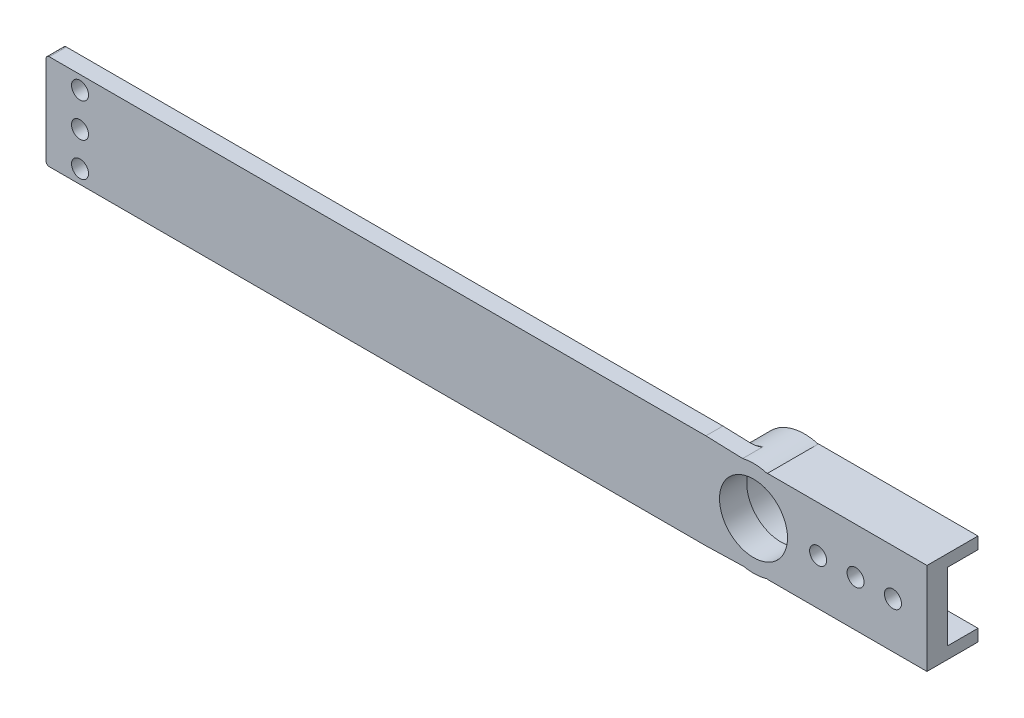
from build123d import *

# Parameters (mm, degrees)
SKETCH_1_W          = 40
SKETCH_1_H          = 20
EXTRUDE_1_DEPTH     = 6
SKETCH_2_R          = 2.5
CUT_EXTRUDE_1_DEPTH = 24.151673806
SKETCH_3_R          = 11
EXTRUDE_2_DEPTH     = 15
SKETCH_5_R          = 11
SKETCH_5_R_2        = 10
EXTRUDE_3_DEPTH     = 8
EXTRUDE_4_DEPTH     = 5
FILLET_1_R          = 1
FILLET_2_R          = 1
SKETCH_9_R          = 2.5
CUT_EXTRUDE_2_DEPTH = 5


with BuildPart() as part:
    # 草图1 → 凸台-拉伸1 (new body)
    with BuildSketch(Plane.XY):
        Rectangle(SKETCH_1_W, SKETCH_1_H)
    extrude(amount=EXTRUDE_1_DEPTH)

    # 草图2 → 切除-拉伸1 (cut, through all)
    with BuildSketch(Plane.XY.offset(6)):
        with Locations((10, 0)):
            Circle(SKETCH_2_R)
        with Locations((-1, 0)):
            Circle(SKETCH_2_R)
        with Locations((-12, 0)):
            Circle(SKETCH_2_R)
    extrude(amount=-CUT_EXTRUDE_1_DEPTH, mode=Mode.SUBTRACT)

    # 草图3 → 凸台-拉伸2 (add)
    with BuildSketch(Plane.XY.offset(6)):
        with BuildLine():
            Line((20, 10), (20, 13.5))
            Line((20, 13.5), (-26.893967141, 13.5))
            Line((-26.893967141, 13.5), (-26.893967141, 13.384337644))
            ThreePointArc((-26.893967141, 13.384337644), (-45, 0), (-26.893967141, -13.384337644))
            Line((-26.893967141, -13.384337644), (-26.893967141, -13.5))
            Line((-26.893967141, -13.5), (20, -13.5))
            Line((20, -13.5), (20, -10))
            Line((20, -10), (-20, -10))
            Line((-20, -10), (-20, -8.660254038))
            ThreePointArc((-20, -8.660254038), (-17, 0), (-20, 8.660254038))
            Line((-20, 8.660254038), (-20, 10))
            Line((-20, 10), (20, 10))
        make_face()
        with Locations((-31, 0)):
            Circle(SKETCH_3_R, mode=Mode.SUBTRACT)
    extrude(amount=-EXTRUDE_2_DEPTH)

    # 草图5 → 凸台-拉伸3 (add)
    with BuildSketch(Plane.XY.offset(6)):
        with Locations((-31, 0)):
            Circle(SKETCH_5_R)
        with Locations((-31, 0)):
            Circle(SKETCH_5_R_2, mode=Mode.SUBTRACT)
    extrude(amount=-EXTRUDE_3_DEPTH)

    # 草图8 → 凸台-拉伸4 (add)
    with BuildSketch(Plane.XY.offset(6)):
        with BuildLine():
            ThreePointArc((-33.911999365, -13.693803697), (-44.999289152, -0.141078849), (-34.187380521, 13.632336755))
            Line((-34.187380521, 13.632336755), (-45, 14))
            Line((-45, 14), (-239, 14))
            Line((-239, 14), (-239, -14))
            Line((-239, -14), (-45, -14))
            Line((-45, -14), (-33.911999365, -13.693803697))
        make_face()
    extrude(amount=-EXTRUDE_4_DEPTH)

    # 圆角1
    fillet_1_edges = [part.edges().sort_by_distance(p)[0] for p in [
        (-44.999289152, -0.141078849, 1),
    ]]
    fillet(fillet_1_edges, radius=FILLET_1_R)

    # 圆角2
    fillet_2_edges = [part.edges().sort_by_distance(p)[0] for p in [
        (-239, 14, 3.5),
        (-239, -14, 3.5),
    ]]
    fillet(fillet_2_edges, radius=FILLET_2_R)

    # 草图9 → 切除-拉伸2 (cut)
    with BuildSketch(Plane.XY.offset(6)):
        with Locations((-229, 0)):
            Circle(SKETCH_9_R)
        with Locations((-229, 10)):
            Circle(SKETCH_9_R)
        with Locations((-229, -10)):
            Circle(SKETCH_9_R)
    extrude(amount=-CUT_EXTRUDE_2_DEPTH, mode=Mode.SUBTRACT)


solid = part.part
